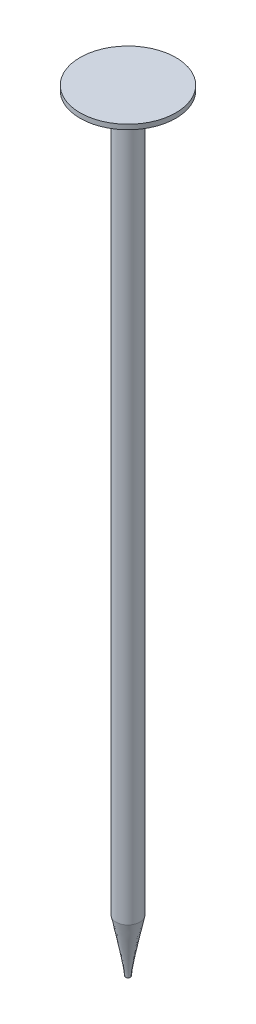
from build123d import *

# Parameters (mm, degrees)
SKETCH1_R           = 25.4
BOSS_EXTRUDE1_DEPTH = 2.54
SKETCH2_R           = 6.35
BOSS_EXTRUDE2_DEPTH = 381


with BuildPart() as part:
    # Sketch1 → Boss-Extrude1 (new body)
    with BuildSketch(Plane(origin=(0, 0, 0), x_dir=(1, 0, 0), z_dir=(0, 1, 0))):
        with Locations(Location((0, 0, 0), (0, 0, 270))):
            Circle(SKETCH1_R)
    extrude(amount=BOSS_EXTRUDE1_DEPTH)

    # Sketch2 → Boss-Extrude2 (add)
    with BuildSketch(Plane(origin=(0, 2.54, 0), x_dir=(1, 0, 0), z_dir=(0, 1, 0))):
        with Locations(Location((0, 0, 0), (0, 0, 270))):
            Circle(SKETCH2_R)
    extrude(amount=-BOSS_EXTRUDE2_DEPTH)

    # Loft1: read off the stored shape, not the designer's step
    # Loft1: loft between two sections, ruled curve by curve
    loft1_from = [
        Edge.make_bspline([(4.913042865, -378.46, -4.022997615), (12.959038094, -378.46, 5.803088115), (3.132952365, -378.46, 13.849083344), (-4.913042865, -378.46, 4.022997615), (-12.959038094, -378.46, -5.803088115), (-3.132952365, -378.46, -13.849083344), (4.913042865, -378.46, -4.022997615)], [0, 0, 0, 0, 0.5, 0.5, 0.5, 1, 1, 1, 1], 3, [1, 0.333333333, 0.333333333, 1, 0.333333333, 0.333333333, 1]),
    ]
    loft1_to = [
        Edge.make_bspline([(-0.252067696, -406.4, -1.244733657), (2.237399617, -406.4, -1.748869049), (2.74153501, -406.4, 0.740598264), (0.252067696, -406.4, 1.244733657), (-2.237399617, -406.4, 1.748869049), (-2.74153501, -406.4, -0.740598264), (-0.252067696, -406.4, -1.244733657)], [0, 0, 0, 0, 0.5, 0.5, 0.5, 1, 1, 1, 1], 3, [1, 0.333333333, 0.333333333, 1, 0.333333333, 0.333333333, 1]),
    ]
    loft1 = Solid(Shell([*[Face.make_surface_from_curves(loft1_from[k], loft1_to[k]) for k in range(1)], Face(Wire(loft1_from)), Face(Wire(loft1_to))]))
    add(loft1)


solid = part.part
